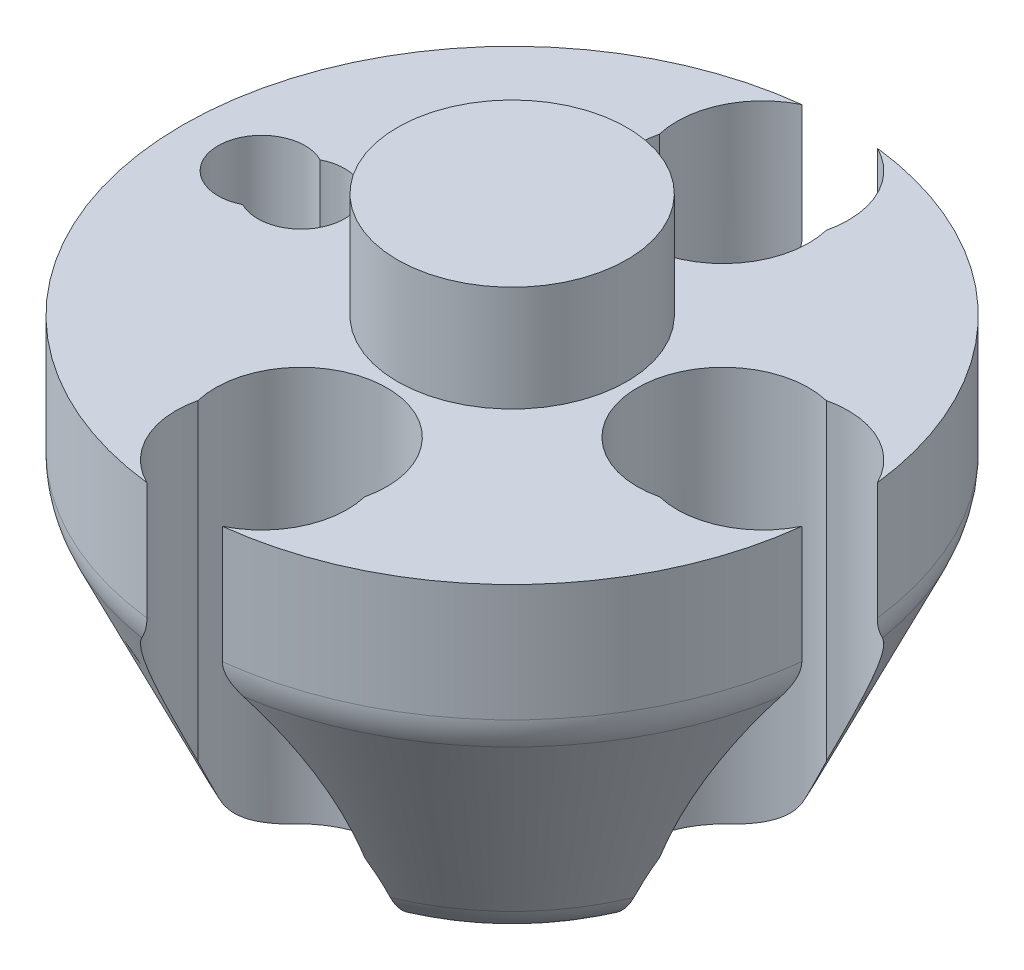
from build123d import *
from build123d.topology import SkipClean

# Parameters (mm, degrees)
SKETCH_1_R          = 4.35
EXTRUDE_1_DEPTH     = 5
EXTRUDE_START       = 5
SKETCH_1_4_R        = 4.35
EXTRUDE_2_DEPTH     = 4
SKETCH_4_R          = 3.1
CUT_EXTRUDE_2_DEPTH = 7
SKETCH_5_R          = 12.5
EXTRUDE_3_DEPTH     = 10
EXTRUDE_3_TAPER     = 25
CUT_EXTRUDE_START   = -10
CUT_EXTRUDE_3_DEPTH = 10
CUT_EXTRUDE_START_2 = 10
SKETCH_4_2_R        = 3.1
CUT_EXTRUDE_4_DEPTH = 10
FILLET_1_R          = 2.5
FILLET_2_R          = 2.5
CUT_EXTRUDE_START_3 = -15
CUT_EXTRUDE_5_DEPTH = 10


# Read off the part's stored shape, not the designer's step: Вырез-Вытянуть3, Вырез-Вытянуть5
with BuildPart() as part:
    # Эскиз1 → Бобышка-Вытянуть1 (new body)
    # profile 1 of 2: a face of its own
    with BuildSketch(Plane(origin=(0, 0, 0), x_dir=(1, 0, 0), z_dir=(0, 1, 0))):
        with BuildLine():
            ThreePointArc((8.75, 3.16227766), (10.886977797, 2.939182299), (12.417763158, 1.431488091))
            ThreePointArc((12.417763158, 1.431488091), (8.838834765, 8.838834765), (1.431488091, 12.417763158))
            ThreePointArc((1.431488091, 12.417763158), (2.758154845, 11.219035152), (3.25, 9.5))
            ThreePointArc((3.25, 9.5), (3.227994919, 9.122443644), (3.16227766, 8.75))
            ThreePointArc((3.16227766, 8.75), (3.227994919, 8.377556356), (3.25, 8))
            ThreePointArc((3.25, 8), (-0.377556356, 4.772005081), (-3.16227766, 8.75))
            ThreePointArc((-3.16227766, 8.75), (-2.939182299, 10.886977797), (-1.431488091, 12.417763158))
            ThreePointArc((-1.431488091, 12.417763158), (-12.5, 0), (-1.431488091, -12.417763158))
            ThreePointArc((-1.431488091, -12.417763158), (-2.939182299, -10.886977797), (-3.16227766, -8.75))
            ThreePointArc((-3.16227766, -8.75), (-0.377556356, -4.772005081), (3.25, -8))
            ThreePointArc((3.25, -8), (3.227994919, -8.377556356), (3.16227766, -8.75))
            ThreePointArc((3.16227766, -8.75), (3.227994919, -9.122443644), (3.25, -9.5))
            ThreePointArc((3.25, -9.5), (2.758154845, -11.219035152), (1.431488091, -12.417763158))
            ThreePointArc((1.431488091, -12.417763158), (8.838834765, -8.838834765), (12.417763158, -1.431488091))
            ThreePointArc((12.417763158, -1.431488091), (10.886977797, -2.939182299), (8.75, -3.16227766))
            ThreePointArc((8.75, -3.16227766), (4.75, 0), (8.75, 3.16227766))
        make_face()
        with BuildLine():
            ThreePointArc((-8.75, -1.469693846), (-11.15, 0), (-8.75, 1.469693846))
            ThreePointArc((-8.75, 1.469693846), (-7.138315603, 1.407124728), (-6.35, 0))
            ThreePointArc((-6.35, 0), (-7.138315603, -1.407124728), (-8.75, -1.469693846))
        make_face(mode=Mode.SUBTRACT)
        Circle(SKETCH_1_R, mode=Mode.SUBTRACT)
    # profile 2 of 2: a face of its own
    with BuildSketch(Plane(origin=(0, 0, 0), x_dir=(1, 0, 0), z_dir=(0, 1, 0))):
        Circle(SKETCH_1_R)
    extrude(amount=EXTRUDE_1_DEPTH)

    # Эскиз1<4> → Бобышка-Вытянуть2 (add)
    with BuildSketch(Plane(origin=(0, 0, 0), x_dir=(1, 0, 0), z_dir=(0, 1, 0)).offset(EXTRUDE_START)):
        with Locations(Location((0, 0, 0), (0, 0, 270))):
            Circle(SKETCH_1_4_R)
    extrude(amount=EXTRUDE_2_DEPTH)

    # Эскиз4 → Вырез-Вытянуть2 (cut)
    with BuildSketch(Plane.XZ):
        with Locations(Location((0, 0, 0), (0, 0, 270))):
            Circle(SKETCH_4_R)
    extrude(amount=-CUT_EXTRUDE_2_DEPTH, mode=Mode.SUBTRACT)

    # Эскиз5 → Бобышка-Вытянуть3 (add)
    with BuildSketch(Plane.XZ):
        Circle(SKETCH_5_R)
    extrude(amount=EXTRUDE_3_DEPTH, taper=EXTRUDE_3_TAPER)

    # Вырез-Вытянуть3 outline → Вырез-Вытянуть3 (cut)
    with SkipClean():  # the faces are left unmerged after this step: merging them gives an invalid solid
        with BuildSketch(Plane(origin=(0, 0, 0), x_dir=(1, 0, 0), z_dir=(0, 1, 0)).offset(CUT_EXTRUDE_START)):
            with BuildLine():
                ThreePointArc((12.417763161, -1.431488068), (12.5, 1.2e-08), (12.417763158, 1.431488091))
                ThreePointArc((12.417763158, 1.431488091), (10.886977798, 2.939182299), (8.750000001, 3.16227766))
                ThreePointArc((8.750000001, 3.16227766), (4.75, 3e-09), (8.749999995, -3.162277661))
                ThreePointArc((8.749999995, -3.162277661), (10.886977806, -2.939182295), (12.417763161, -1.431488068))
            make_face()
            with BuildLine():
                ThreePointArc((1.431488068, 12.417763161), (-1.2e-08, 12.5), (-1.431488091, 12.417763158))
                ThreePointArc((-1.431488091, 12.417763158), (-2.939182299, 10.886977798), (-3.16227766, 8.750000001))
                ThreePointArc((-3.16227766, 8.750000001), (-3e-09, 4.75), (3.162277661, 8.749999995))
                ThreePointArc((3.162277661, 8.749999995), (2.939182295, 10.886977806), (1.431488068, 12.417763161))
            make_face()
            with BuildLine():
                ThreePointArc((-1.431488068, -12.417763161), (1.2e-08, -12.5), (1.431488091, -12.417763158))
                ThreePointArc((1.431488091, -12.417763158), (2.939182299, -10.886977798), (3.16227766, -8.750000001))
                ThreePointArc((3.16227766, -8.750000001), (3e-09, -4.75), (-3.162277661, -8.749999995))
                ThreePointArc((-3.162277661, -8.749999995), (-2.939182295, -10.886977806), (-1.431488068, -12.417763161))
            make_face()
            with BuildLine():
                ThreePointArc((-8.750000004, -1.469693844), (-6.35, 0), (-8.750000004, 1.469693843))
                ThreePointArc((-8.750000004, 1.469693843), (-11.15, -1e-09), (-8.750000004, -1.469693844))
            make_face()
        extrude(amount=CUT_EXTRUDE_3_DEPTH, mode=Mode.SUBTRACT)

    # Эскиз4<2> → Вырез-Вытянуть4 (cut)
    with SkipClean():  # the faces are left unmerged after this step: merging them gives an invalid solid
        with BuildSketch(Plane.XZ.offset(CUT_EXTRUDE_START_2)):
            with Locations(Location((0, 0, 0), (0, 0, 270))):
                Circle(SKETCH_4_2_R)
        extrude(amount=-CUT_EXTRUDE_4_DEPTH, mode=Mode.SUBTRACT)

    # Скругление1
    fillet_1_edges = [part.edges().sort_by_distance(p)[0] for p in [
        (8.838834765, 0, 8.838834765),
        (8.838834765, 0, -8.838834765),
        (-12.5, 0, 0),
        (5.541541693, -10, -5.541541693),
        (5.541541693, -10, 5.541541693),
    ]]
    fillet(fillet_1_edges, radius=FILLET_1_R)

    # Скругление2
    # the kernel refuses this fillet: 2.5 mm, written as the material it takes off along each edge
    with BuildSketch(Plane(origin=(0, -10, 0), x_dir=(-0.955216832334961, 0, -0.2959067475134066), z_dir=(0.2959067475134066, 0, -0.955216832334961))) as fillet_2_piece_1:
        with BuildLine():
            CenterArc((7.836923418 - FILLET_2_R * 0.637070260807, FILLET_2_R), FILLET_2_R, 270, 65)
            Line((7.836923418 + FILLET_2_R * 0.269237526229, FILLET_2_R * 0.577381738259), (7.836923418, 0))
            Line((7.836923418, 0), (7.836923418 - FILLET_2_R * 0.637070260807, 0))
        make_face()
    fillet_2_piece_1_solid = revolve(axis=Axis((0, -10, 0), (0, 1, 0)), revolution_arc=112.670974686, mode=Mode.PRIVATE)
    with BuildSketch(Plane(origin=(0, -10, 0), x_dir=(0.09513442436434995, 0, -0.9954644349753856), z_dir=(0.9954644349753856, 0, 0.09513442436434995))) as fillet_2_piece_2:
        with BuildLine():
            CenterArc((7.836923418 - FILLET_2_R * 0.637070260807, FILLET_2_R), FILLET_2_R, 270, 65)
            Line((7.836923418 + FILLET_2_R * 0.269237526229, FILLET_2_R * 0.577381738259), (7.836923418, 0))
            Line((7.836923418, 0), (7.836923418 - FILLET_2_R * 0.637070260807, 0))
        make_face()
    fillet_2_piece_2_solid = revolve(axis=Axis((0, -10, 0), (0, 1, 0)), revolution_arc=112.67097469, mode=Mode.PRIVATE)
    add([fillet_2_piece_1_solid, fillet_2_piece_2_solid], mode=Mode.SUBTRACT)

    # Вырез-Вытянуть5 outline → Вырез-Вытянуть5 (cut)
    with BuildSketch(Plane(origin=(0, 5, 0), x_dir=(1, 0, 0), z_dir=(0, 1, 0)).offset(CUT_EXTRUDE_START_3)):
        with BuildLine():
            ThreePointArc((-8.750000004, -2.697684191), (-5.2, 0), (-8.750000004, 2.697684191))
            ThreePointArc((-8.750000004, 2.697684191), (-12.3, 7e-09), (-8.750000004, -2.697684191))
        make_face()
        with BuildLine():
            ThreePointArc((-8.749999956, -1.469693823), (-11.15, -1e-09), (-8.749999959, 1.469693825))
            ThreePointArc((-8.749999959, 1.469693825), (-6.35, 0), (-8.749999956, -1.469693823))
        make_face(mode=Mode.SUBTRACT)
    extrude(amount=CUT_EXTRUDE_5_DEPTH, mode=Mode.SUBTRACT)


solid = part.part
